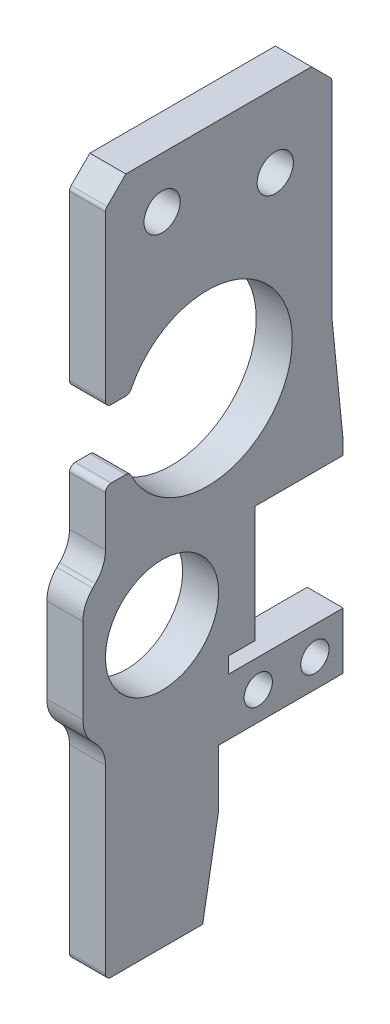
from build123d import *

# Parameters (mm, degrees)
SKETCH1_R           = 5
SKETCH1_R_2         = 1.6
SKETCH1_R_3         = 1.25
BOSS_EXTRUDE1_DEPTH = 3.18
CHAMFER1_SIZE       = 8
CHAMFER1_SIZE2      = 1.410615846
CUT_EXTRUDE5_DEPTH  = 65.412487143
FILLET2_R           = 3
CHAMFER3_SIZE       = 1
CHAMFER3_SIZE_2     = 10
CHAMFER2_SIZE       = 1.8
FILLET4_R           = 0.5


with BuildPart() as part:
    # Sketch1 → Boss-Extrude1 (new body)
    with BuildSketch(Plane(origin=(0, 0, 0), x_dir=(0, 0, -1), z_dir=(1, 0, 0))):
        Polygon((0, 0), (0, 17.7), (-2, 19.7), (-2, 29.7), (0, 31.7), (0, 60.81), (20, 60.81), (20, 40.81), (21, 40.81), (21, 29.68), (13.2, 29.68), (13.2, 19.4), (10.85, 19.4), (10.85, 18), (21, 18), (21, 13), (10, 13), (10, 0), align=None)
        with Locations(Location((5, 24.7, 0), (0, 0, 180))):
            Circle(SKETCH1_R, mode=Mode.SUBTRACT)
        with Locations(Location((5, 56.31, 0), (0, 0, 180))):
            Circle(SKETCH1_R_2, mode=Mode.SUBTRACT)
        with Locations(Location((15, 54.31, 0), (0, 0, 180))):
            Circle(SKETCH1_R_2, mode=Mode.SUBTRACT)
        with Locations(Location((18.5, 15.5, 0), (0, 0, 180))):
            Circle(SKETCH1_R_3, mode=Mode.SUBTRACT)
        with Locations(Location((13.5, 15.5, 0), (0, 0, 180))):
            Circle(SKETCH1_R_3, mode=Mode.SUBTRACT)
    extrude(amount=BOSS_EXTRUDE1_DEPTH)

    # Chamfer1
    chamfer1_edges = [part.edges().sort_by_distance(p)[0] for p in [
        (1.59, 0, -10),
    ]]
    chamfer1_side = [part.faces().sort_by_distance(p)[0] for p in [
        (1.59, 6.5, -10),
    ]]
    chamfer(chamfer1_edges, length=CHAMFER1_SIZE, length2=CHAMFER1_SIZE2, reference=chamfer1_side[0])

    # Sketch8 → Cut-Extrude5 (cut, through all)
    with BuildSketch(Plane(origin=(3.18, 0, 0), x_dir=(0, 0, -1), z_dir=(1, 0, 0))):
        with BuildLine():
            Line((0, 43.810865899), (2.126136458, 43.810865899))
            ThreePointArc((2.126136458, 43.810865899), (16.5, 40.810865899), (2.126136458, 37.810865899))
            Line((2.126136458, 37.810865899), (0, 37.810865899))
            Line((0, 37.810865899), (0, 43.810865899))
        make_face()
    extrude(amount=-CUT_EXTRUDE5_DEPTH, mode=Mode.SUBTRACT)

    # Fillet2
    fillet2_edges = [part.edges().sort_by_distance(p)[0] for p in [
        (1.59, 17.7, 0),
        (1.59, 19.7, 2),
        (1.59, 29.7, 2),
        (1.59, 31.7, 0),
    ]]
    fillet(fillet2_edges, radius=FILLET2_R)

    # Chamfer3
    # the kernel refuses this chamfer: 10, 1 mm, written as the material it takes off along each edge
    with BuildSketch(Plane(origin=(-25.99522763, 40.81, -21), x_dir=(0, 0.3574851447578462, 0.9339188247794675), z_dir=(1, 0, 0))) as chamfer3_piece_1:
        Polygon((CHAMFER3_SIZE * 0.933918824779, CHAMFER3_SIZE * 0.357485144758), (-CHAMFER3_SIZE_2 * 0.357485144758, CHAMFER3_SIZE_2 * 0.933918824779), (0, 0), align=None)
    extrude(amount=55.170455259, mode=Mode.SUBTRACT)

    # Chamfer2
    chamfer2_edges = [part.edges().sort_by_distance(p)[0] for p in [
        (1.59, 60.81, 0),
        (1.59, 60.81, -20),
    ]]
    chamfer(chamfer2_edges, length=CHAMFER2_SIZE)

    # Fillet4
    fillet4_edges = [part.edges().sort_by_distance(p)[0] for p in [
        (1.59, 59.01, -20),
        (1.59, 59.01, 0),
        (1.59, 0, 0),
        (1.59, 37.810865899, 0),
        (1.59, 43.810865899, 0),
        (1.59, 43.810865899, -2.126136458),
        (1.59, 37.810865899, -2.126136458),
    ]]
    fillet(fillet4_edges, radius=FILLET4_R)


solid = part.part
